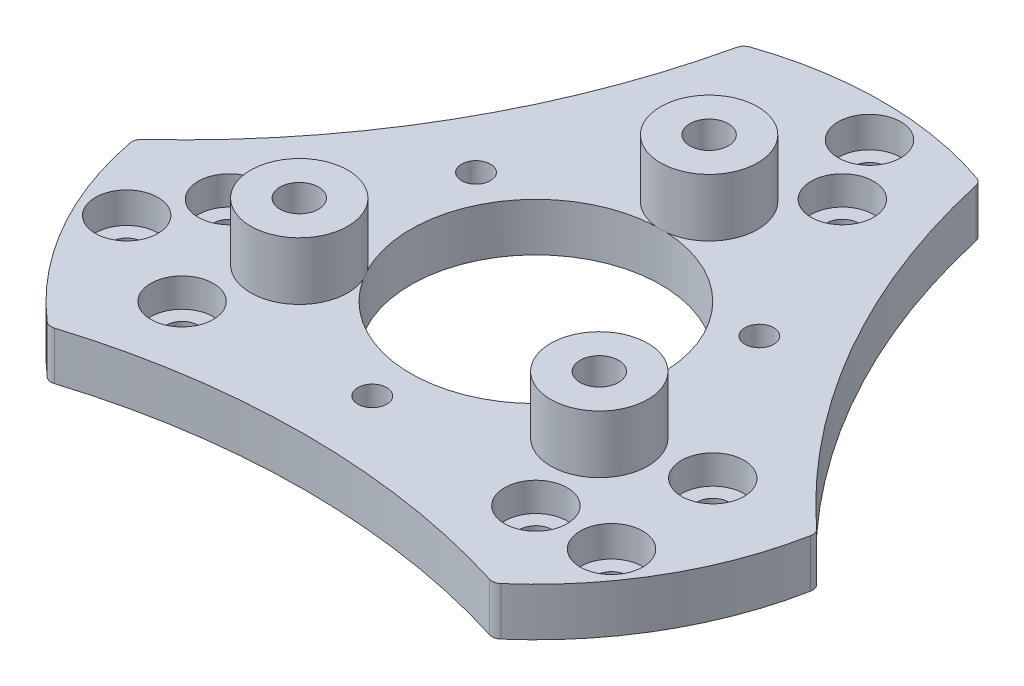
from build123d import *

# Parameters (mm, degrees)
SKETCH1_R           = 36
SKETCH1_R_2         = 13
BOSS_EXTRUDE1_DEPTH = 5
SKETCH2_R           = 1.65
CUT_EXTRUDE1_DEPTH  = 52.15662225
CIRPATTERN1_COUNT   = 3
SKETCH3_R           = 76.029468034
CUT_EXTRUDE2_DEPTH  = 10
CIRPATTERN2_COUNT   = 3
FILLET1_R           = 1
SKETCH4_R           = 5.05
BOSS_EXTRUDE2_DEPTH = 6
SKETCH7_R           = 3.25
CUT_EXTRUDE5_DEPTH  = 3.2
CIRPATTERN3_COUNT   = 3
SKETCH8_R           = 1.5
CUT_EXTRUDE6_DEPTH  = 10
SKETCH12_R          = 2
CUT_EXTRUDE8_DEPTH  = 52.652535358
CIRPATTERN4_COUNT   = 3
SKETCH13_R          = 1.7
CUT_EXTRUDE9_DEPTH  = 51.823069631
CIRPATTERN5_COUNT   = 3
SKETCH14_R          = 3.25
CUT_EXTRUDE10_DEPTH = 3


with BuildPart() as part:
    # Sketch1 → Boss-Extrude1 (new body)
    with BuildSketch(Plane(origin=(0, 0, 0), x_dir=(1, 0, 0), z_dir=(0, 1, 0))):
        Circle(SKETCH1_R)
        Circle(SKETCH1_R_2, mode=Mode.SUBTRACT)
    extrude(amount=BOSS_EXTRUDE1_DEPTH)

    # Sketch2 → Cut-Extrude1 (cut, through all)
    with BuildSketch(Plane(origin=(0, 5, 0), x_dir=(1, 0, 0), z_dir=(0, 1, 0))):
        with Locations((2.788983768, 31.878230339)):
            Circle(SKETCH2_R)
    cut_extrude1 = extrude(amount=-CUT_EXTRUDE1_DEPTH, mode=Mode.SUBTRACT)

    # CirPattern1: Cut-Extrude1 ×3 about axis
    cirpattern1_axis = Axis((0, 5, 0), (0, -1, 0))
    for i in range(1, CIRPATTERN1_COUNT):
        add(cut_extrude1.rotate(cirpattern1_axis, i * 360 / CIRPATTERN1_COUNT), mode=Mode.SUBTRACT)

    # Sketch3 → Cut-Extrude2 (cut)
    with BuildSketch(Plane(origin=(0, 5, 0), x_dir=(1, 0, 0), z_dir=(0, 1, 0))):
        with Locations((86.602540378, 50)):
            Circle(SKETCH3_R)
    cut_extrude2 = extrude(amount=-CUT_EXTRUDE2_DEPTH, mode=Mode.SUBTRACT)

    # CirPattern2: Cut-Extrude2 ×3 about axis
    cirpattern2_axis = Axis((0, 5, 0), (0, -1, 0))
    for i in range(1, CIRPATTERN2_COUNT):
        add(cut_extrude2.rotate(cirpattern2_axis, i * 360 / CIRPATTERN2_COUNT), mode=Mode.SUBTRACT)

    # Fillet1
    fillet1_edges = [part.edges().sort_by_distance(p)[0] for p in [
        (23.140353949, 2.5, 27.577599952),
        (-23.140353949, 2.5, 27.577599952),
        (-35.453079108, 2.5, 6.251334396),
        (-12.31272516, 2.5, -33.828934348),
        (35.453079108, 2.5, 6.251334396),
        (12.31272516, 2.5, -33.828934348),
    ]]
    fillet(fillet1_edges, radius=FILLET1_R)

    # Sketch4 → Boss-Extrude2 (add)
    with BuildSketch(Plane(origin=(0, 5, 0), x_dir=(1, 0, 0), z_dir=(0, 1, 0))):
        with Locations((0, 18)):
            Circle(SKETCH4_R)
    boss_extrude2 = extrude(amount=BOSS_EXTRUDE2_DEPTH)

    # Sketch7 → Cut-Extrude5 (cut)
    with BuildSketch(Plane(origin=(0, 5, 0), x_dir=(1, 0, 0), z_dir=(0, 1, 0))):
        with Locations((2.788983768, 31.878230339)):
            Circle(SKETCH7_R)
    cut_extrude5 = extrude(amount=-CUT_EXTRUDE5_DEPTH, mode=Mode.SUBTRACT)

    # CirPattern3: Boss-Extrude2, Cut-Extrude5 ×3 about axis
    cirpattern3_axis = Axis((0, 5, 0), (0, -1, 0))
    add([boss_extrude2.rotate(cirpattern3_axis, i * 360 / CIRPATTERN3_COUNT) for i in range(1, CIRPATTERN3_COUNT)])
    add([cut_extrude5.rotate(cirpattern3_axis, i * 360 / CIRPATTERN3_COUNT) for i in range(1, CIRPATTERN3_COUNT)], mode=Mode.SUBTRACT)

    # Sketch8 → Cut-Extrude6 (cut)
    with BuildSketch(Plane(origin=(0, 5, 0), x_dir=(1, 0, 0), z_dir=(0, 1, 0))):
        with Locations((14.722431864, 8.5)):
            Circle(SKETCH8_R)
    cut_extrude6 = extrude(amount=-CUT_EXTRUDE6_DEPTH, mode=Mode.SUBTRACT)

    # Sketch12 → Cut-Extrude8 (cut, through all)
    with BuildSketch(Plane(origin=(0, 11, 0), x_dir=(1, 0, 0), z_dir=(0, 1, 0))):
        with Locations((0, 18)):
            Circle(SKETCH12_R)
    cut_extrude8 = extrude(amount=-CUT_EXTRUDE8_DEPTH, mode=Mode.SUBTRACT)

    # CirPattern4: Cut-Extrude6, Cut-Extrude8 ×3 about axis
    cirpattern4_axis = Axis((0, 5, 0), (0, -1, 0))
    add([cut_extrude6.rotate(cirpattern4_axis, i * 360 / CIRPATTERN4_COUNT) for i in range(1, CIRPATTERN4_COUNT)], mode=Mode.SUBTRACT)
    add([cut_extrude8.rotate(cirpattern4_axis, i * 360 / CIRPATTERN4_COUNT) for i in range(1, CIRPATTERN4_COUNT)], mode=Mode.SUBTRACT)

    # Sketch13 → Cut-Extrude9 (cut, through all)
    with BuildSketch(Plane(origin=(0, 5, 0), x_dir=(1, 0, 0), z_dir=(0, 1, 0))):
        with Locations((6.729295173, 25.114071484)):
            Circle(SKETCH13_R)
        with Locations((-6.729295173, 25.114071484)):
            Circle(SKETCH13_R)
    cut_extrude9 = extrude(amount=-CUT_EXTRUDE9_DEPTH, mode=Mode.SUBTRACT)

    # CirPattern5: Cut-Extrude9 ×3 about axis
    cirpattern5_axis = Axis((0, 5, 0), (0, -1, 0))
    for i in range(1, CIRPATTERN5_COUNT):
        add(cut_extrude9.rotate(cirpattern5_axis, i * 360 / CIRPATTERN5_COUNT), mode=Mode.SUBTRACT)

    # Sketch14 → Cut-Extrude10 (cut)
    with BuildSketch(Plane(origin=(0, 5, 0), x_dir=(1, 0, 0), z_dir=(0, 1, 0))):
        with Locations((-18.384776311, -18.384776311)):
            Circle(SKETCH14_R)
        with Locations((-25.114071484, -6.729295173)):
            Circle(SKETCH14_R)
        with Locations((-6.729295173, 25.114071484)):
            Circle(SKETCH14_R)
        with Locations((6.729295173, 25.114071484)):
            Circle(SKETCH14_R)
        with Locations((25.114071484, -6.729295173)):
            Circle(SKETCH14_R)
        with Locations((18.384776311, -18.384776311)):
            Circle(SKETCH14_R)
    extrude(amount=-CUT_EXTRUDE10_DEPTH, mode=Mode.SUBTRACT)


solid = part.part
